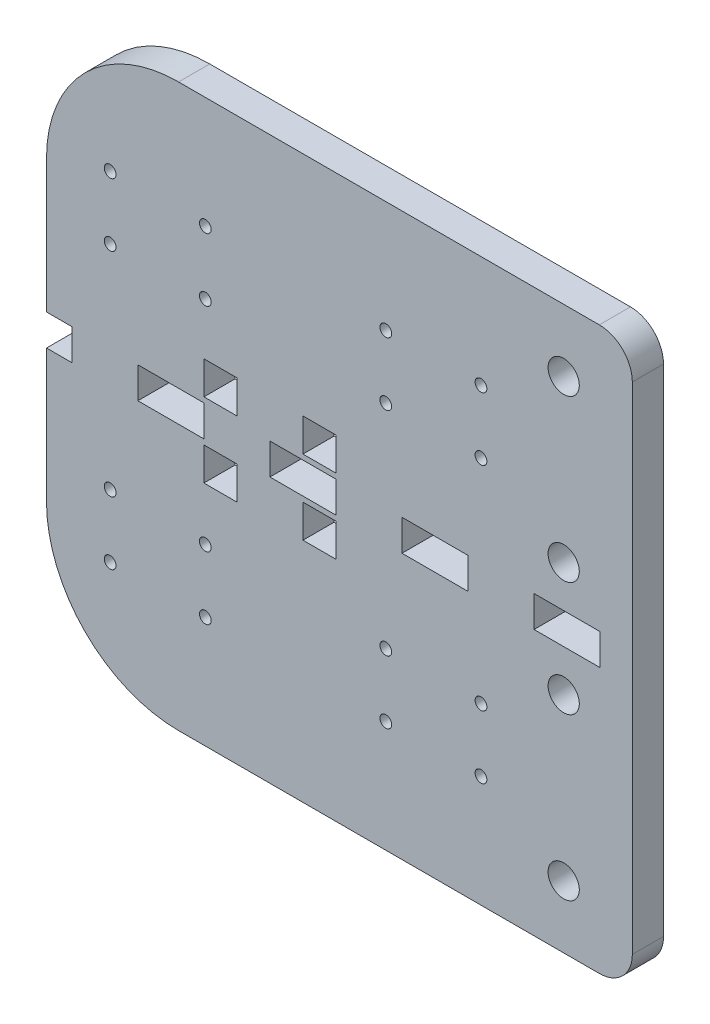
from build123d import *

# Parameters (mm, degrees)
SKETCH1_R           = 3
SKETCH1_R_2         = 1.13211215
SKETCH1_W           = 6.35
SKETCH1_H           = 6.35
SKETCH1_W_2         = 12.7
SKETCH1_H_2         = 5.9944
BOSS_EXTRUDE1_DEPTH = 5.9944


with BuildPart() as part:
    # Sketch1 → Boss-Extrude1 (new body)
    with BuildSketch(Plane(origin=(0, 0, 0), x_dir=(-1, 0, 0), z_dir=(0, 0, 1))):
        with BuildLine():
            Line((45.302589937, 52.692109768), (19.902589937, 52.692109768))
            Line((19.902589937, 52.692109768), (-35.623445702, 52.692109768))
            ThreePointArc((-35.623445702, 52.692109768), (-40.113573763, 50.832237829), (-41.973445702, 46.342109768))
            Line((-41.973445702, 46.342109768), (-41.973445702, -49.004229729))
            ThreePointArc((-41.973445702, -49.004229729), (-40.113573763, -53.494357789), (-35.623445702, -55.354229729))
            Line((-35.623445702, -55.354229729), (19.902589937, -55.354229729))
            Line((19.902589937, -55.354229729), (45.302589937, -55.354229729))
            ThreePointArc((45.302589937, -55.354229729), (63.263102179, -47.914741971), (70.702589937, -29.954229729))
            Line((70.702589937, -29.954229729), (70.702589937, -4.32825998))
            Line((70.702589937, -4.32825998), (65.829579937, -4.32825998))
            Line((65.829579937, -4.32825998), (65.829579937, 1.66614002))
            Line((65.829579937, 1.66614002), (70.702589937, 1.66614002))
            Line((70.702589937, 1.66614002), (70.702589937, 27.292109768))
            ThreePointArc((70.702589937, 27.292109768), (63.263102179, 45.25262201), (45.302589937, 52.692109768))
        make_face()
        with Locations((-28.770420063, -43.34064498)):
            Circle(SKETCH1_R, mode=Mode.SUBTRACT)
        with Locations((-12.862735063, -33.89562768)):
            Circle(SKETCH1_R_2, mode=Mode.SUBTRACT)
        with Locations((5.444904937, -33.89562768)):
            Circle(SKETCH1_R_2, mode=Mode.SUBTRACT)
        with Locations((-28.770420063, -12.34064498)):
            Circle(SKETCH1_R, mode=Mode.SUBTRACT)
        with Locations((-12.862735063, -21.78027768)):
            Circle(SKETCH1_R_2, mode=Mode.SUBTRACT)
        with Locations((5.444904937, -21.78027768)):
            Circle(SKETCH1_R_2, mode=Mode.SUBTRACT)
        with Locations((40.156434997, -33.90101228)):
            Circle(SKETCH1_R_2, mode=Mode.SUBTRACT)
        with Locations((58.464074997, -33.90101228)):
            Circle(SKETCH1_R_2, mode=Mode.SUBTRACT)
        with Locations((40.156434997, -21.78566228)):
            Circle(SKETCH1_R_2, mode=Mode.SUBTRACT)
        with Locations((18.204579937, -8.50605998)):
            Rectangle(SKETCH1_W, SKETCH1_H, mode=Mode.SUBTRACT)
        with Locations((37.254579937, -8.50605998)):
            Rectangle(SKETCH1_W, SKETCH1_H, mode=Mode.SUBTRACT)
        with Locations((58.464074997, -21.78566228)):
            Circle(SKETCH1_R_2, mode=Mode.SUBTRACT)
        with Locations((-29.420420063, -1.33105998)):
            Rectangle(SKETCH1_W_2, SKETCH1_H_2, mode=Mode.SUBTRACT)
        with Locations((-28.770420063, 9.67852502)):
            Circle(SKETCH1_R, mode=Mode.SUBTRACT)
        with Locations((-4.020420063, -1.33105998)):
            Rectangle(SKETCH1_W_2, SKETCH1_H_2, mode=Mode.SUBTRACT)
        with Locations((-12.862735063, 19.11815772)):
            Circle(SKETCH1_R_2, mode=Mode.SUBTRACT)
        with Locations((5.444904937, 19.11815772)):
            Circle(SKETCH1_R_2, mode=Mode.SUBTRACT)
        with Locations((-28.770420063, 40.67852502)):
            Circle(SKETCH1_R, mode=Mode.SUBTRACT)
        with Locations((-12.862735063, 31.23350772)):
            Circle(SKETCH1_R_2, mode=Mode.SUBTRACT)
        with Locations((5.444904937, 31.23350772)):
            Circle(SKETCH1_R_2, mode=Mode.SUBTRACT)
        with Locations((21.379579937, -1.33105998)):
            Rectangle(SKETCH1_W_2, SKETCH1_H_2, mode=Mode.SUBTRACT)
        with Locations((18.204579937, 5.84394002)):
            Rectangle(SKETCH1_W, SKETCH1_H, mode=Mode.SUBTRACT)
        with Locations((37.254579937, 5.84394002)):
            Rectangle(SKETCH1_W, SKETCH1_H, mode=Mode.SUBTRACT)
        with Locations((40.156434997, 19.11815772)):
            Circle(SKETCH1_R_2, mode=Mode.SUBTRACT)
        with Locations((46.779579937, -1.33105998)):
            Rectangle(SKETCH1_W_2, SKETCH1_H_2, mode=Mode.SUBTRACT)
        with Locations((58.464074997, 19.11815772)):
            Circle(SKETCH1_R_2, mode=Mode.SUBTRACT)
        with Locations((40.156434997, 31.23350772)):
            Circle(SKETCH1_R_2, mode=Mode.SUBTRACT)
        with Locations((58.464074997, 31.23350772)):
            Circle(SKETCH1_R_2, mode=Mode.SUBTRACT)
    extrude(amount=BOSS_EXTRUDE1_DEPTH)


solid = part.part
